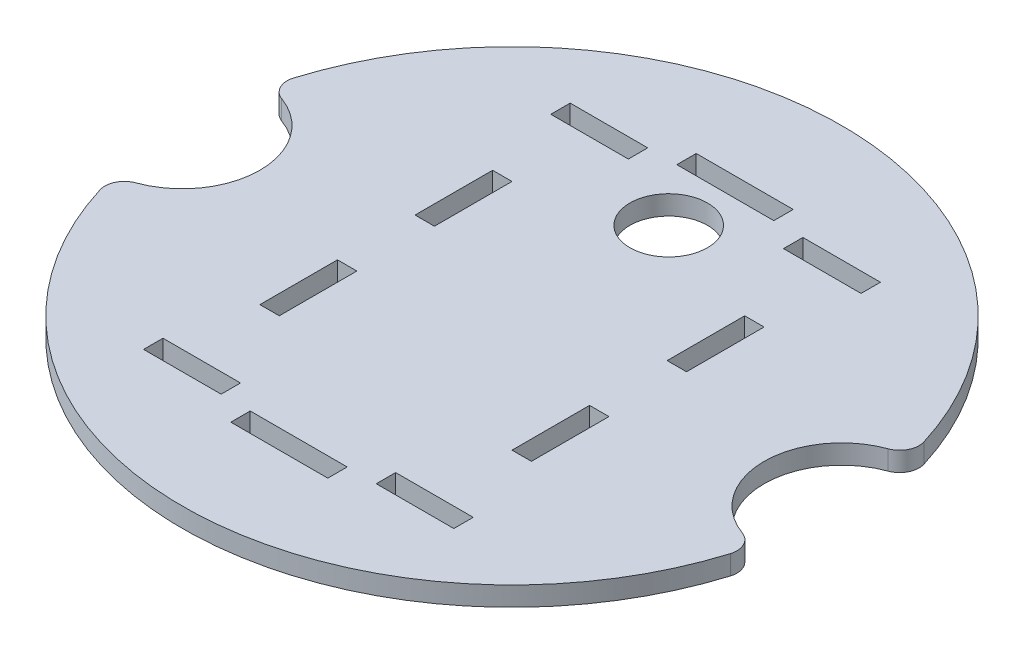
from build123d import *

# Parameters (mm, degrees)
SKETCH1_R           = 12.7
SKETCH1_W           = 25.4
SKETCH1_H           = 6.35
SKETCH1_W_2         = 6.35
SKETCH1_H_2         = 25.4
SKETCH1_W_3         = 31.75
BOSS_EXTRUDE1_DEPTH = 6.35


with BuildPart() as part:
    # Sketch1 → Boss-Extrude1 (new body)
    with BuildSketch(Plane(origin=(0, 0, 0), x_dir=(1, 0, 0), z_dir=(0, 1, 0))):
        with BuildLine():
            ThreePointArc((-103.1875, -31.710287664), (0, -107.95), (103.1875, -31.710287664))
            ThreePointArc((103.1875, -31.710287664), (102.801250262, -27.013165433), (99.284117647, -23.8759813))
            ThreePointArc((99.284117647, -23.8759813), (82.55, 0), (99.284117647, 23.8759813))
            ThreePointArc((99.284117647, 23.8759813), (102.801250262, 27.013165433), (103.1875, 31.710287664))
            ThreePointArc((103.1875, 31.710287664), (0, 107.95), (-103.1875, 31.710287664))
            ThreePointArc((-103.1875, 31.710287664), (-102.801250262, 27.013165433), (-99.284117647, 23.8759813))
            ThreePointArc((-99.284117647, 23.8759813), (-82.55, 0), (-99.284117647, -23.8759813))
            ThreePointArc((-99.284117647, -23.8759813), (-102.801250262, -27.013165433), (-103.1875, -31.710287664))
        make_face()
        with Locations((0, 51.308)):
            Circle(SKETCH1_R, mode=Mode.SUBTRACT)
        with Locations((-38.1, 66.675)):
            Rectangle(SKETCH1_W, SKETCH1_H, mode=Mode.SUBTRACT)
        with Locations((38.1, 66.675)):
            Rectangle(SKETCH1_W, SKETCH1_H, mode=Mode.SUBTRACT)
        with Locations((-38.1, -66.675)):
            Rectangle(SKETCH1_W, SKETCH1_H, mode=Mode.SUBTRACT)
        with Locations((38.1, -66.675)):
            Rectangle(SKETCH1_W, SKETCH1_H, mode=Mode.SUBTRACT)
        with Locations((41.275, -25.4)):
            Rectangle(SKETCH1_W_2, SKETCH1_H_2, mode=Mode.SUBTRACT)
        with Locations((41.275, 25.4)):
            Rectangle(SKETCH1_W_2, SKETCH1_H_2, mode=Mode.SUBTRACT)
        with Locations((-41.275, -25.4)):
            Rectangle(SKETCH1_W_2, SKETCH1_H_2, mode=Mode.SUBTRACT)
        with Locations((-41.275, 25.4)):
            Rectangle(SKETCH1_W_2, SKETCH1_H_2, mode=Mode.SUBTRACT)
        with Locations((0, 73.025)):
            Rectangle(SKETCH1_W_3, SKETCH1_H, mode=Mode.SUBTRACT)
        with Locations((0, -73.025)):
            Rectangle(SKETCH1_W_3, SKETCH1_H, mode=Mode.SUBTRACT)
    extrude(amount=BOSS_EXTRUDE1_DEPTH)


solid = part.part
